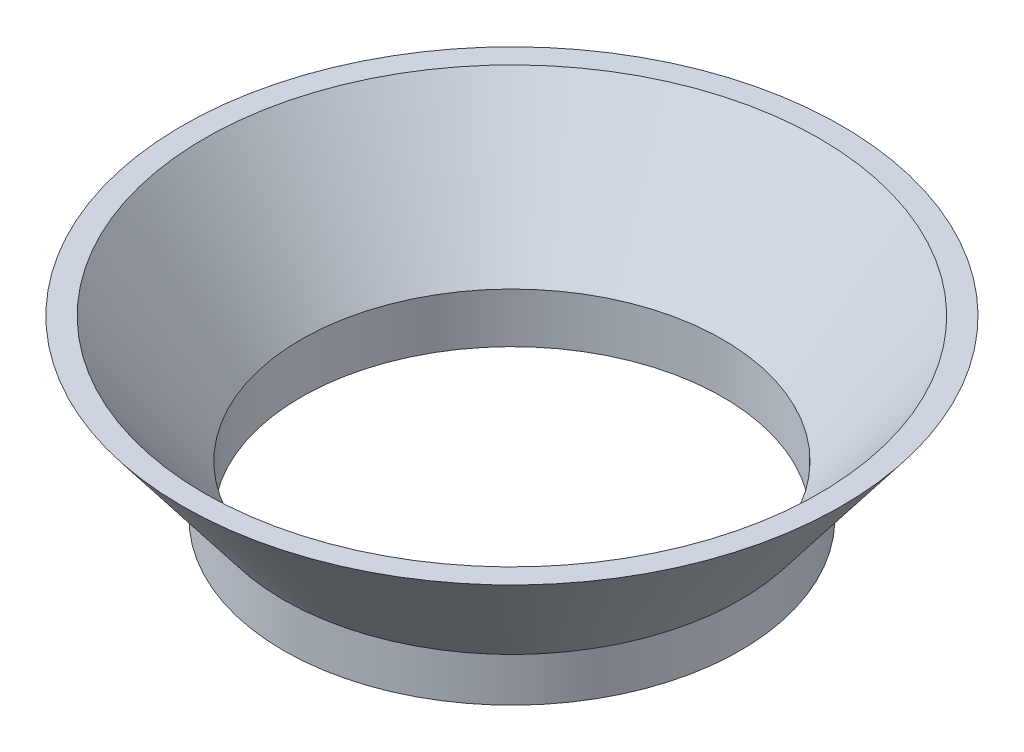
from build123d import *


with BuildPart() as part:
    # Esquisse1 → Révolution1 (revolve)
    with BuildSketch(Plane.XY):
        Polygon((26, 0), (26, 5), (37.521920434, 20), (35, 20), (24, 5.679470628), (24, 0), align=None)
    revolve(axis=Axis((0, 21, 0), (0, -1, 0)))


solid = part.part
